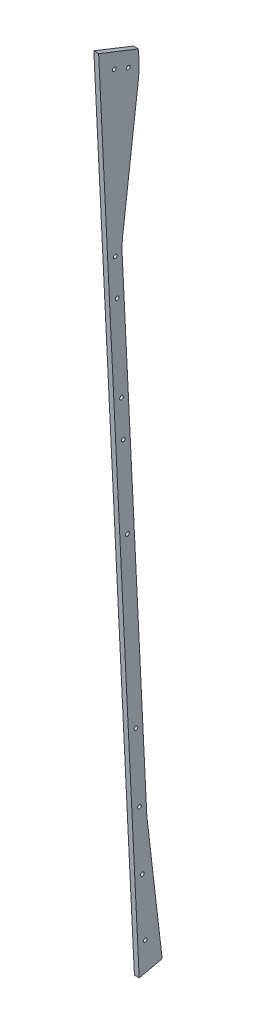
from build123d import *

# Parameters (mm, degrees)
STOCK_LEFT_START                                  = 154.501049255
STOCK_LEFT_CONSOLE_1_OUTLINE_R                    = 2.413
STOCK_LEFT_CONSOLE_1_DEPTH                        = 6.35
SKETCH1_R                                         = 2.413
BOSS_EXTRUDE1_DEPTH                               = 6.35
FILLET1_R                                         = 127
CSK_FOR_8_FLAT_HEAD_MACHINE_SCREW_100_D           = 4.9149
CSK_FOR_8_FLAT_HEAD_MACHINE_SCREW_100_DEPTH       = 36.56137815
CSK_FOR_8_FLAT_HEAD_MACHINE_SCREW_100_CSINK_D     = 8.4328
CSK_FOR_8_FLAT_HEAD_MACHINE_SCREW_100_CSINK_ANGLE = 100


# Read off the part's stored shape, not the designer's step: Stock-Left Console-1
with BuildPart() as part:
    # Stock-Left Console-1 outline → Stock-Left Console-1 (new body)
    with BuildSketch(Plane(origin=(0, 0, 0), x_dir=(0.02679964301193732, 0.9996408236099973, -5.391436833640836e-05), z_dir=(0.999638800759929, -0.0267996972431853, -0.00201103031422956)).offset(STOCK_LEFT_START)):
        Polygon((6894.543157626, 3344.380142713), (5775.416554865, 3260.371330561), (5781.349946418, 3234.680487062), (5961.468932714, 3260.009915697), (6652.879217668, 3311.911600999), (6881.420614343, 3311.911600999), align=None)
        with Locations((5816.052887601, 3253.393618776)):
            Circle(STOCK_LEFT_CONSOLE_1_OUTLINE_R, mode=Mode.SUBTRACT)
        with Locations((5895.828437121, 3259.382082581)):
            Circle(STOCK_LEFT_CONSOLE_1_OUTLINE_R, mode=Mode.SUBTRACT)
        with Locations((5977.356983496, 3265.50213756)):
            Circle(STOCK_LEFT_CONSOLE_1_OUTLINE_R, mode=Mode.SUBTRACT)
        with Locations((6072.652614823, 3272.65563813)):
            Circle(STOCK_LEFT_CONSOLE_1_OUTLINE_R, mode=Mode.SUBTRACT)
        with Locations((6307.675625814, 3290.29797094)):
            Circle(STOCK_LEFT_CONSOLE_1_OUTLINE_R, mode=Mode.SUBTRACT)
        with Locations((6422.028102237, 3298.882000385)):
            Circle(STOCK_LEFT_CONSOLE_1_OUTLINE_R, mode=Mode.SUBTRACT)
        with Locations((6472.834946762, 3302.695887614)):
            Circle(STOCK_LEFT_CONSOLE_1_OUTLINE_R, mode=Mode.SUBTRACT)
        with Locations((6592.955295229, 3311.712890485)):
            Circle(STOCK_LEFT_CONSOLE_1_OUTLINE_R, mode=Mode.SUBTRACT)
        with Locations((6643.762139775, 3315.526777715)):
            Circle(STOCK_LEFT_CONSOLE_1_OUTLINE_R, mode=Mode.SUBTRACT)
        with Locations((6865.316700097, 3322.905070324)):
            Circle(STOCK_LEFT_CONSOLE_1_OUTLINE_R, mode=Mode.SUBTRACT)
    extrude(amount=STOCK_LEFT_CONSOLE_1_DEPTH)

    # Sketch1 → Boss-Extrude1 (add)
    with BuildSketch(Plane(origin=(154.445243594, -4.140581344, -0.310706294), x_dir=(0.002010307996697838, -5.389511255073478e-05, 0.9999979778764931), z_dir=(-0.9996388007599293, 0.026799697243176115, 0.0020110303142280403))):
        Polygon((3259.688501477, 5961.644685781), (3234.3687839, 5781.524334123), (3229.743043385, 5782.592402631), (3254.912621388, 5961.644685781), (3306.77702959, 6653.057767982), (3288.626337955, 6847.775838873), (3290.526309625, 6873.104678319), (3311.540587989, 6881.599164324), (3311.552909679, 6653.057767982), align=None)
        with Locations(Location((3303.484925533, 6857.795366229, 0), (0, 0, 270))):
            Circle(SKETCH1_R, mode=Mode.SUBTRACT)
    extrude(amount=-BOSS_EXTRUDE1_DEPTH)

    # Fillet1
    # the kernel refuses this fillet: 127 mm, written as the material it adds along each edge
    with BuildSketch(Plane(origin=(320.759216191, 5955.187389877, 3254.595333259), x_dir=(-0.026818667254060527, -0.9899007533718392, -0.13920221823153914), z_dir=(0.9996388007599292, -0.026799697243176112, -0.00201103031422804))) as fillet1_piece_1:
        with BuildLine():
            CenterArc((FILLET1_R * 0.0324033639177, FILLET1_R), FILLET1_R, 266.288146769, 3.711853231)
            Line((-FILLET1_R * 0.0323353896511, FILLET1_R * 0.00209775339147), (0, 0))
            Line((0, 0), (FILLET1_R * 0.0324033639177, 0))
        make_face()
    extrude(amount=6.35)
    with BuildSketch(Plane(origin=(339.393178368, 6646.349336581, 3306.459636585), x_dir=(-0.02687504446974266, -0.9968362003292489, -0.07480188298361883), z_dir=(0.9996388007599292, -0.026799697243176112, -0.00201103031422804))) as fillet1_piece_2:
        with BuildLine():
            CenterArc((FILLET1_R * 0.0841067955983, FILLET1_R), FILLET1_R, 260.38470128, 9.61529872)
            Line((-FILLET1_R * 0.0829252189667, FILLET1_R * 0.0140485275074), (0, 0))
            Line((0, 0), (FILLET1_R * 0.0841067955983, 0))
        make_face()
    extrude(amount=6.35)
    # the kernel refuses this fillet: 127 mm, written as the material it takes off along each edge
    with BuildSketch(Plane(origin=(317.880823616, 6841.714103927, 3288.36268402), x_dir=(0.026875044469742655, 0.996836200329251, 0.0748018829835892), z_dir=(0.9996388007599292, -0.026799697243176112, -0.00201103031422804))) as fillet1_2_piece_1:
        with BuildLine():
            CenterArc((FILLET1_R * 0.0841067955983, FILLET1_R), FILLET1_R, 260.38470128, 9.61529872)
            Line((-FILLET1_R * 0.0829252189667, FILLET1_R * 0.0140485275074), (0, 0))
            Line((0, 0), (FILLET1_R * 0.0841067955982, 0))
        make_face()
    extrude(amount=59.757815205, mode=Mode.SUBTRACT)

    # CSK for #8 Flat Head Machine Screw (100)1
    with Locations(Plane(origin=(154.445243594, -4.140581344, -0.310706294), x_dir=(0.002010307996697838, -5.389511255073478e-05, 0.9999979778764931), z_dir=(-0.9996388007599293, 0.026799697243176115, 0.0020110303142280403))):
        with Locations((3322.534925533, 6865.49584281), (3303.484925533, 6857.795366229), (3315.168577933, 6643.940885012), (3311.357429933, 6593.133834917), (3302.346903301, 6473.013000478), (3298.535755302, 6422.205950402), (3289.957891123, 6307.853011342), (3272.328229482, 6072.829049515), (3265.179866736, 5977.533032649), (3259.064207335, 5896.004156434), (3253.080044595, 5816.228284164)):
            CounterSinkHole(CSK_FOR_8_FLAT_HEAD_MACHINE_SCREW_100_D / 2, CSK_FOR_8_FLAT_HEAD_MACHINE_SCREW_100_CSINK_D / 2, depth=CSK_FOR_8_FLAT_HEAD_MACHINE_SCREW_100_DEPTH, counter_sink_angle=CSK_FOR_8_FLAT_HEAD_MACHINE_SCREW_100_CSINK_ANGLE)


solid = part.part
